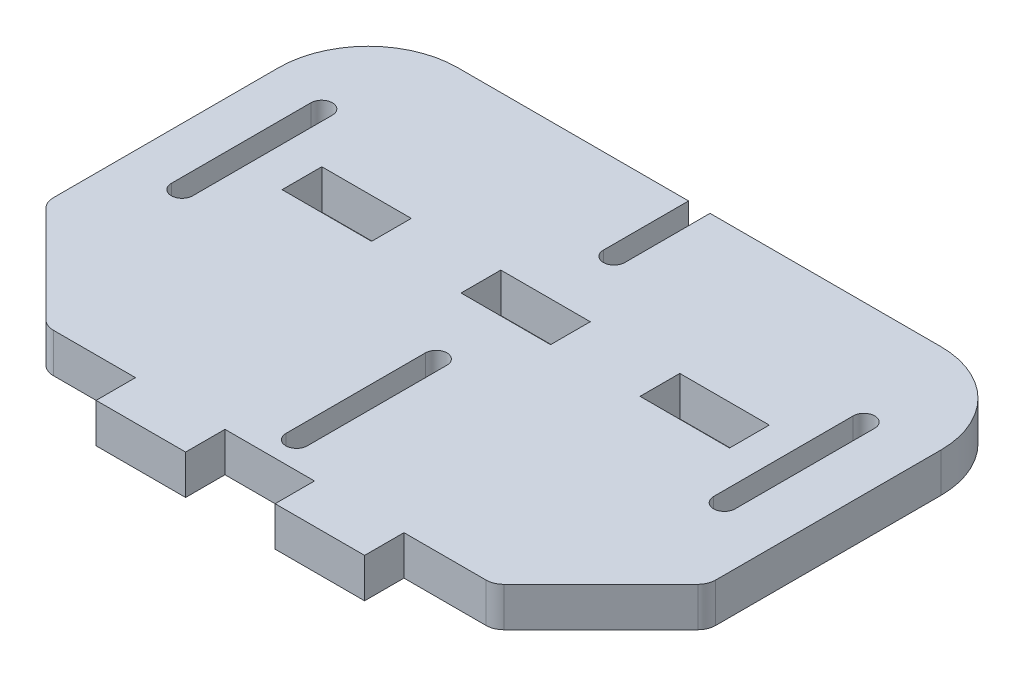
from build123d import *

# Parameters (mm, degrees)
BOSS_EXTRUDE6_DEPTH = 11
SKETCH4_W           = 25
SKETCH4_H           = 11
SKETCH4_H_2         = 11.1
CUT_EXTRUDE1_DEPTH  = 199.489924177
FILLET1_R           = 25
FILLET2_R           = 5


with BuildPart() as part:
    # Sketch1 → Boss-Extrude6 (new body)
    with BuildSketch(Plane(origin=(0, 0, 0), x_dir=(1, 0, 0), z_dir=(0, 1, 0))):
        with BuildLine():
            Line((0, -7.5), (125, -7.5))
            Line((125, -7.5), (125, 3.5))
            Line((125, 3.5), (155, 33.5))
            Line((155, 33.5), (155, 123.5))
            Line((155, 123.5), (65.5, 123.5))
            Line((65.5, 123.5), (65.5, 99.705746838))
            ThreePointArc((65.5, 99.705746838), (62.5, 96.705746838), (59.5, 99.705746838))
            Line((59.5, 99.705746838), (59.5, 123.5))
            Line((59.5, 123.5), (-30, 123.5))
            Line((-30, 123.5), (-30, 33.5))
            Line((-30, 33.5), (0, 3.5))
            Line((0, 3.5), (0, -7.5))
        make_face()
        with BuildLine():
            Line((134.5, 55.5), (134.5, 94.5))
            ThreePointArc((134.5, 94.5), (137.5, 97.5), (140.5, 94.5))
            Line((140.5, 94.5), (140.5, 55.5))
            ThreePointArc((140.5, 55.5), (137.5, 52.5), (134.5, 55.5))
        make_face(mode=Mode.SUBTRACT)
        with BuildLine():
            Line((-17, 55.5), (-17, 94.5))
            ThreePointArc((-17, 94.5), (-14, 97.5), (-11, 94.5))
            Line((-11, 94.5), (-11, 55.5))
            ThreePointArc((-11, 55.5), (-14, 52.5), (-17, 55.5))
        make_face(mode=Mode.SUBTRACT)
        with BuildLine():
            Line((59.5, 11), (59.5, 50))
            ThreePointArc((59.5, 50), (62.5, 53), (65.5, 50))
            Line((65.5, 50), (65.5, 11))
            ThreePointArc((65.5, 11), (62.5, 8), (59.5, 11))
        make_face(mode=Mode.SUBTRACT)
    extrude(amount=BOSS_EXTRUDE6_DEPTH)

    # Sketch4 → Cut-Extrude1 (cut, through all)
    with BuildSketch(Plane(origin=(0, 11, 0), x_dir=(1, 0, 0), z_dir=(0, 1, 0))):
        with Locations((12.5, -2)):
            Rectangle(SKETCH4_W, SKETCH4_H)
        with Locations((62.5, -2)):
            Rectangle(SKETCH4_W, SKETCH4_H)
        with Locations((12.5, 75)):
            Rectangle(SKETCH4_W, SKETCH4_H_2)
        with Locations((112.5, -2)):
            Rectangle(SKETCH4_W, SKETCH4_H)
        with Locations((62.5, 75)):
            Rectangle(SKETCH4_W, SKETCH4_H_2)
        with Locations((112.5, 75)):
            Rectangle(SKETCH4_W, SKETCH4_H_2)
    extrude(amount=-CUT_EXTRUDE1_DEPTH, mode=Mode.SUBTRACT)

    # Fillet1
    fillet1_edges = [part.edges().sort_by_distance(p)[0] for p in [
        (155, 5.5, -123.5),
        (-30, 5.5, -123.5),
    ]]
    fillet(fillet1_edges, radius=FILLET1_R)

    # Fillet2
    fillet2_edges = [part.edges().sort_by_distance(p)[0] for p in [
        (155, 5.5, -33.5),
        (125, 5.5, -3.5),
        (0, 5.5, -3.5),
        (-30, 5.5, -33.5),
    ]]
    fillet(fillet2_edges, radius=FILLET2_R)


solid = part.part
